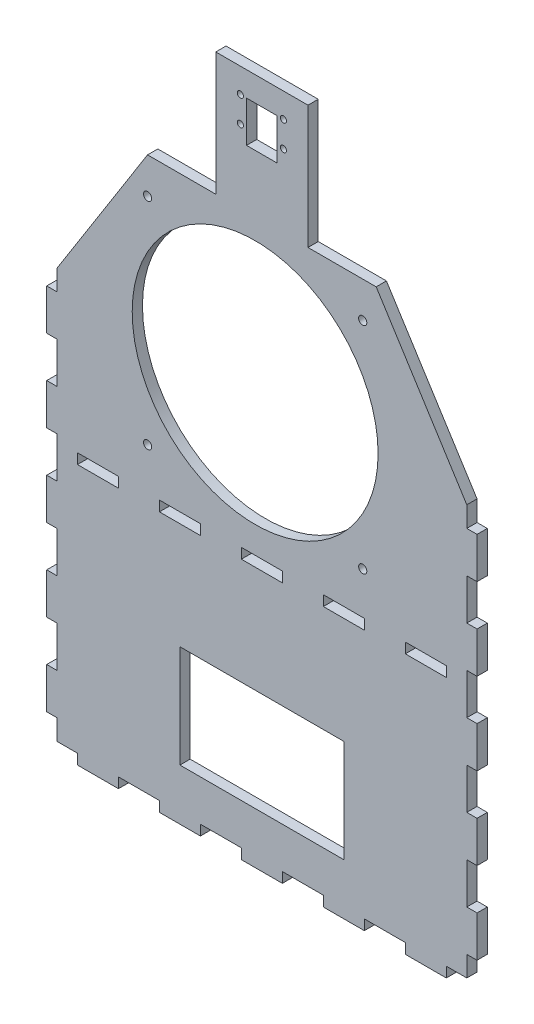
from build123d import *

# Parameters (mm, degrees)
SKICA1_W                = 20
SKICA1_H                = 5
SKICA1_R                = 2
SKICA1_W_2              = 80
SKICA1_H_2              = 50
SKICA1_R_2              = 60
SKICA1_R_3              = 1.5
SKICA1_W_3              = 15
SKICA1_H_3              = 20
P_IDAT_VYSUNUT_M1_DEPTH = 5


with BuildPart() as part:
    # Skica1 → Přidat vysunutím1 (new body)
    with BuildSketch(Plane.XY):
        Polygon((-121.598141023, -103.240049383), (-121.598141023, -113.240049383), (-111.598141023, -113.240049383), (-111.598141023, -118.240049383), (-91.598141023, -118.240049383), (-91.598141023, -113.240049383), (-71.598141023, -113.240049383), (-71.598141023, -118.240049383), (-51.598141023, -118.240049383), (-51.598141023, -113.240049383), (-31.598141023, -113.240049383), (-31.598141023, -118.240049383), (-11.598141023, -118.240049383), (-11.598141023, -113.240049383), (8.401858977, -113.240049383), (8.401858977, -118.240049383), (28.401858977, -118.240049383), (28.401858977, -113.240049383), (48.401858977, -113.240049383), (48.401858977, -118.240049383), (68.401858977, -118.240049383), (68.401858977, -113.240049383), (78.401858977, -113.240049383), (78.401858977, -103.240049383), (83.401858977, -103.240049383), (83.401858977, -83.240049383), (78.401858977, -83.240049383), (78.401858977, -63.240049383), (83.401858977, -63.240049383), (83.401858977, -43.240049383), (78.401858977, -43.240049383), (78.401858977, -23.240049383), (83.401858977, -23.240049383), (83.401858977, -3.240049383), (78.401858977, -3.240049383), (78.401858977, 16.759950617), (83.401858977, 16.759950617), (83.401858977, 36.759950617), (78.401858977, 36.759950617), (78.401858977, 56.759950617), (83.401858977, 56.759950617), (83.401858977, 76.759950617), (78.401858977, 76.759950617), (78.401858977, 86.759950617), (34.183586154, 156.759950617), (0.901858977, 156.759950617), (0.901858977, 216.89905968), (-44.098141023, 216.89905968), (-44.098141023, 156.759950617), (-77.379868199, 156.759950617), (-121.598141023, 86.759950617), (-121.598141023, 76.759950617), (-126.598141023, 76.759950617), (-126.598141023, 56.759950617), (-121.598141023, 56.759950617), (-121.598141023, 36.759950617), (-126.598141023, 36.759950617), (-126.598141023, 16.759950617), (-121.598141023, 16.759950617), (-121.598141023, -3.240049383), (-126.598141023, -3.240049383), (-126.598141023, -23.240049383), (-121.598141023, -23.240049383), (-121.598141023, -43.240049383), (-126.598141023, -43.240049383), (-126.598141023, -63.240049383), (-121.598141023, -63.240049383), (-121.598141023, -83.240049383), (-126.598141023, -83.240049383), (-126.598141023, -103.240049383), align=None)
        with Locations((-101.598141023, 11.259950617)):
            Rectangle(SKICA1_W, SKICA1_H, mode=Mode.SUBTRACT)
        with Locations((-77.379868199, 34.259950617)):
            Circle(SKICA1_R, mode=Mode.SUBTRACT)
        with Locations((-61.598141023, 11.259950617)):
            Rectangle(SKICA1_W, SKICA1_H, mode=Mode.SUBTRACT)
        with Locations((-21.598141023, -68.240049383)):
            Rectangle(SKICA1_W_2, SKICA1_H_2, mode=Mode.SUBTRACT)
        with Locations((-21.598141023, 11.259950617)):
            Rectangle(SKICA1_W, SKICA1_H, mode=Mode.SUBTRACT)
        with Locations((18.401858977, 11.259950617)):
            Rectangle(SKICA1_W, SKICA1_H, mode=Mode.SUBTRACT)
        with Locations((27.620131801, 34.259950617)):
            Circle(SKICA1_R, mode=Mode.SUBTRACT)
        with Locations((58.401858977, 11.259950617)):
            Rectangle(SKICA1_W, SKICA1_H, mode=Mode.SUBTRACT)
        with Locations((-24.879868199, 86.759950617)):
            Circle(SKICA1_R_2, mode=Mode.SUBTRACT)
        with Locations((-77.379868199, 139.259950617)):
            Circle(SKICA1_R, mode=Mode.SUBTRACT)
        with Locations((27.620131801, 139.259950617)):
            Circle(SKICA1_R, mode=Mode.SUBTRACT)
        with Locations((-11.098141023, 204.89905968)):
            Circle(SKICA1_R_3, mode=Mode.SUBTRACT)
        with Locations((-32.098141023, 192.39905968)):
            Circle(SKICA1_R_3, mode=Mode.SUBTRACT)
        with Locations((-32.098141023, 204.89905968)):
            Circle(SKICA1_R_3, mode=Mode.SUBTRACT)
        with Locations((-21.598141023, 194.89905968)):
            Rectangle(SKICA1_W_3, SKICA1_H_3, mode=Mode.SUBTRACT)
        with Locations((-11.098141023, 192.39905968)):
            Circle(SKICA1_R_3, mode=Mode.SUBTRACT)
    extrude(amount=P_IDAT_VYSUNUT_M1_DEPTH)


solid = part.part
